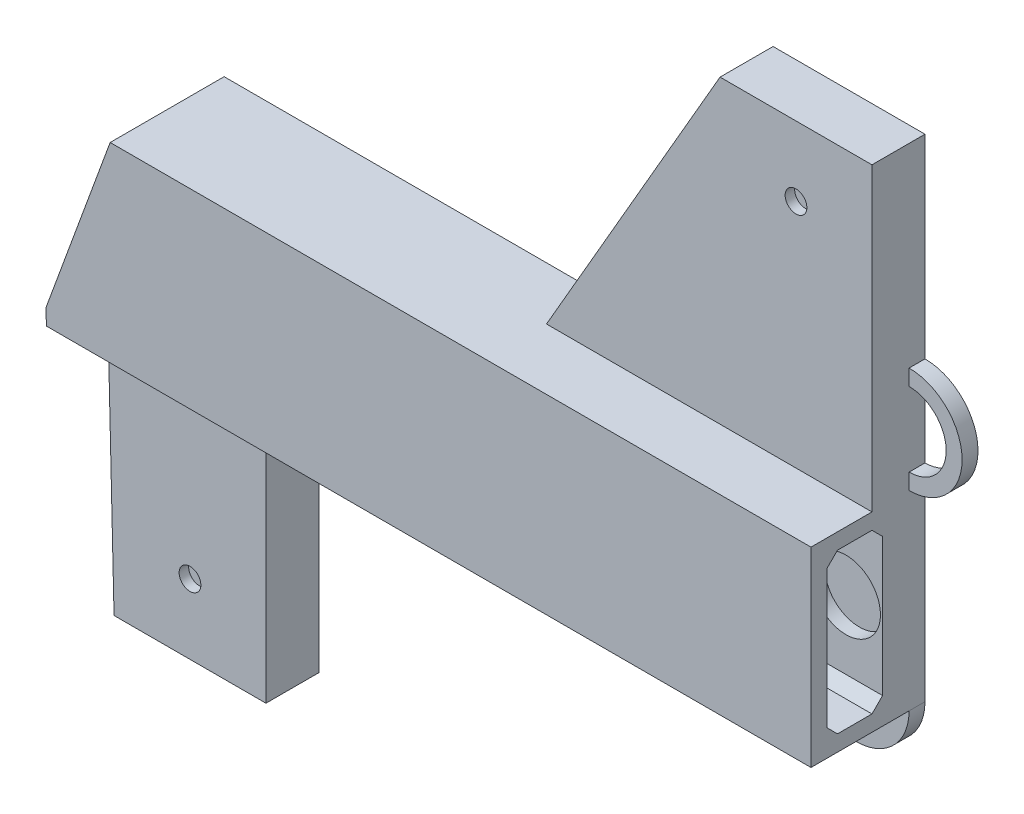
from build123d import *

# Parameters (mm, degrees)
SKETCH3_W             = 22.65000000000009
SKETCH3_H             = 20.30000000000004
SKETCH3_W_2           = 22.64999999999995
BOSS_EXTRUDE1_DEPTH   = 8
SKETCH3_4_R           = 2.049999999999966
SKETCH3_4_R_2         = 2.0499999999999923
BOSS_EXTRUDE2_DEPTH   = 2
BOSS_EXTRUDE3_DEPTH   = 13.5
SKETCH4_W             = 10.499999999999998
SKETCH4_H             = 30.000000000000014
CUT_EXTRUDE1_DEPTH    = 219.62824070668816
CHAMFER1_SIZE         = 2
SKETCH7_R             = 6.500000000000016
CUT_EXTRUDE3_DEPTH    = 2.5
SKETCH8_R             = 6.500000000000016
CUT_EXTRUDE4_DEPTH    = 7
BOSS_EXTRUDE4_DEPTH   = 3
BOSS_EXTRUDE4_2_DEPTH = 3
SKETCH3_9_R           = 2.0499999999999923
SKETCH3_9_R_2         = 2.049999999999966
BOSS_EXTRUDE5_DEPTH   = 0.2


with BuildPart() as part:
    # Sketch3 → Boss-Extrude1 (new body)
    with BuildSketch(Plane.XY):
        Polygon((-289.50446528221903, 74), (-288.1687500000001, 18.600000000000023), (-259.51875, 18.600000000000023), (-259.51875, 71), (-145.21875, 71), (-145.21875, 163.70000000000002), (-173.86874999999995, 163.70000000000002), (-206.60451026305154, 107), (-277.4071095129883, 106.99999999999999), align=None)
        with Locations((-273.84375000000006, 31.750000000000043)):
            Rectangle(SKETCH3_W, SKETCH3_H, mode=Mode.SUBTRACT)
        with Locations((-159.54375, 150.55)):
            Rectangle(SKETCH3_W_2, SKETCH3_H, mode=Mode.SUBTRACT)
    extrude(amount=-BOSS_EXTRUDE1_DEPTH)



with BuildPart() as body_2:
    # Sketch3<4> → Boss-Extrude2 (new body)
    with BuildSketch(Plane.XY):
        Polygon((-289.50446528221903, 74), (-288.1687500000001, 18.600000000000023), (-259.51875, 18.600000000000023), (-259.51875, 71), (-145.21875, 71), (-145.21875, 163.70000000000002), (-173.86874999999995, 163.70000000000002), (-206.60451026305154, 107), (-277.4071095129883, 106.99999999999999), align=None)
        with Locations((-273.84375, 31.749999999999986)):
            Circle(SKETCH3_4_R, mode=Mode.SUBTRACT)
        with Locations((-159.54375, 150.55)):
            Circle(SKETCH3_4_R_2, mode=Mode.SUBTRACT)
    extrude(amount=BOSS_EXTRUDE2_DEPTH)


with BuildPart() as part_1:
    add(part.part)

    add(body_2.part)  # Boss-Extrude3 merges body 2
    # Sketch3<8> → Boss-Extrude3 (add)
    with BuildSketch(Plane.XY):
        Polygon((-288.1687500000001, 77.64365611411853), (-288.1687500000001, 70.99999999999999), (-259.51875, 71), (-145.21875, 71), (-145.21875, 107), (-206.60451026305154, 107), (-277.4071095129883, 106.99999999999999), align=None)
        Polygon((-289.4321341297523, 70.99999999999999), (-288.1687500000001, 70.99999999999999), (-288.1687500000001, 77.64365611411853), (-289.50446528221903, 74), align=None)
    extrude(amount=BOSS_EXTRUDE3_DEPTH)

    # Sketch4 → Cut-Extrude1 (cut, through all)
    with BuildSketch(Plane(origin=(-145.21875, 0, 0), x_dir=(0, 0, -1), z_dir=(1, 0, 0))):
        with Locations((-5.249999999999999, 89)):
            Rectangle(SKETCH4_W, SKETCH4_H)
    extrude(amount=-CUT_EXTRUDE1_DEPTH, mode=Mode.SUBTRACT)

    # Chamfer1
    chamfer1_edges = [part_1.edges().sort_by_distance(p)[0] for p in [
        (-217.36160764110952, 74, 10.499999999999998),
        (-211.86280956418642, 104, 10.499999999999998),
        (-211.86280956418642, 104, 0),
        (-217.36160764110952, 74, 0),
    ]]
    chamfer(chamfer1_edges, length=CHAMFER1_SIZE)

    # Sketch7 → Cut-Extrude3 (cut)
    with BuildSketch(Plane.XY):
        with Locations((-152.11875000000003, 88.99999999999999)):
            Circle(SKETCH7_R)
    extrude(amount=-CUT_EXTRUDE3_DEPTH, mode=Mode.SUBTRACT)

    # Sketch8 → Cut-Extrude4 (cut)
    with BuildSketch(Plane(origin=(0, 0, -8), x_dir=(-1, 0, 0), z_dir=(0, 0, -1))):
        with Locations((234.21875, 89)):
            Circle(SKETCH8_R)
    extrude(amount=-CUT_EXTRUDE4_DEPTH, mode=Mode.SUBTRACT)

    # Sketch3<9> → Boss-Extrude5 (add)
    with BuildSketch(Plane.XY):
        with Locations((-159.54375, 150.55)):
            Circle(SKETCH3_9_R)
        with Locations((-273.84375, 31.749999999999986)):
            Circle(SKETCH3_9_R_2)
    extrude(amount=BOSS_EXTRUDE5_DEPTH)


with BuildPart() as body_2_2:
    # Sketch9 → Boss-Extrude4 (new body)
    with BuildSketch(Plane(origin=(0, 0, -8), x_dir=(-1, 0, 0), z_dir=(0, 0, -1))):
        with BuildLine():
            ThreePointArc((145.21875000000003, 71), (155.21875000000003, 60.999999999999986), (165.21875000000003, 71))
            Line((165.21875000000003, 71), (162.21875000000003, 71))
            ThreePointArc((162.21875000000006, 71), (155.21875000000003, 63.999999999999986), (148.21875, 71))
            Line((148.21875, 71), (145.21875, 71))
        make_face()
    extrude(amount=-BOSS_EXTRUDE4_DEPTH)


with BuildPart() as body_3:
    # Sketch9 → Boss-Extrude4 2 (new body)
    with BuildSketch(Plane(origin=(0, 0, -8), x_dir=(-1, 0, 0), z_dir=(0, 0, -1))):
        with BuildLine():
            Line((145.21875, 124.00000000000001), (145.21875, 127))
            ThreePointArc((145.21875, 127.00000000000001), (135.21875, 117), (145.21875, 106.99999999999999))
            Line((145.21875, 107), (145.21875, 109.99999999999997))
            ThreePointArc((145.21875, 109.99999999999999), (138.21874999999997, 117), (145.21875, 124.00000000000001))
        make_face()
    extrude(amount=-BOSS_EXTRUDE4_2_DEPTH)


solid = Compound([part_1.part, body_2_2.part, body_3.part])
